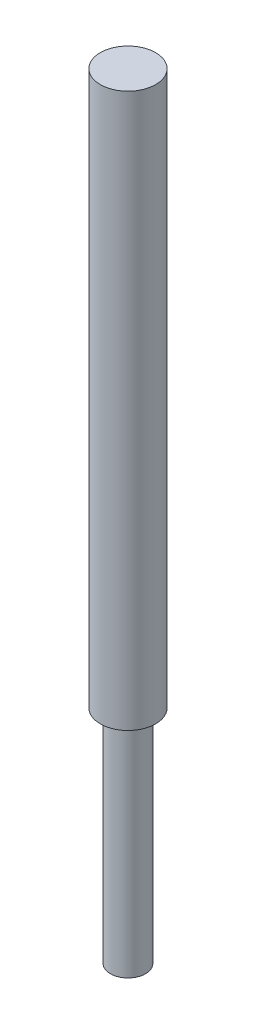
from build123d import *

# Parameters (mm, degrees)
SKETCH1_R           = 6.35
BOSS_EXTRUDE1_DEPTH = 80
SKETCH2_R           = 10
BOSS_EXTRUDE2_DEPTH = 200


with BuildPart() as part:
    # Sketch1 → Boss-Extrude1 (new body)
    with BuildSketch(Plane(origin=(0, 0, 0), x_dir=(1, 0, 0), z_dir=(0, 1, 0))):
        Circle(SKETCH1_R)
    extrude(amount=BOSS_EXTRUDE1_DEPTH)

    # Sketch2 → Boss-Extrude2 (add)
    with BuildSketch(Plane(origin=(0, 80, 0), x_dir=(1, 0, 0), z_dir=(0, 1, 0))):
        Circle(SKETCH2_R)
    extrude(amount=BOSS_EXTRUDE2_DEPTH)


solid = part.part
